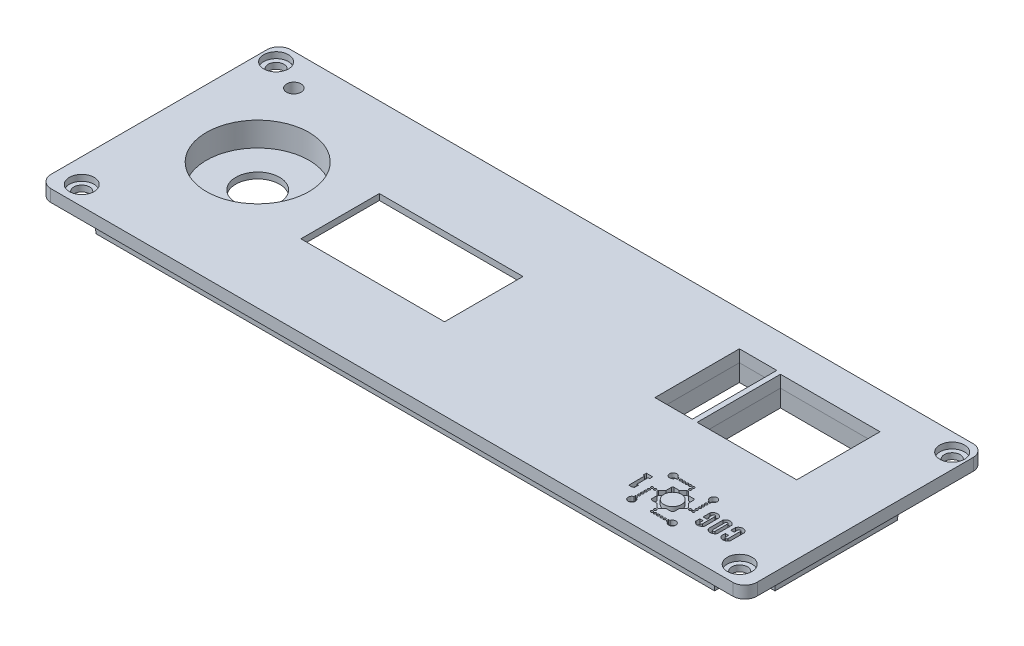
from build123d import *

# Parameters (mm, degrees)
SKETCH1_R                     = 1.3
BOSS_EXTRUDE1_DEPTH           = 2
SKETCH3_W                     = 102.8
SKETCH3_H                     = 1.5
BOSS_EXTRUDE2_DEPTH           = 3
BOSS_EXTRUDE2_DRAFT           = 3
BOSS_EXTRUDE2_PROFILE_2_DEPTH = 3
BOSS_EXTRUDE2_PROFILE_2_DRAFT = 3
SKETCH3_W_2                   = 1.5
SKETCH3_H_2                   = 20.6
BOSS_EXTRUDE2_PROFILE_3_DEPTH = 3
BOSS_EXTRUDE2_PROFILE_3_DRAFT = 3
BOSS_EXTRUDE2_PROFILE_4_DEPTH = 3
BOSS_EXTRUDE2_PROFILE_4_DRAFT = 3
SKETCH6_R                     = 2.05
CUT_EXTRUDE3_DEPTH            = 1
SKETCH8_W                     = 27.3
SKETCH8_H                     = 27.8
BOSS_EXTRUDE16_DEPTH          = 0.5
CUT_EXTRUDE8_DEPTH            = 1.5
SKETCH10_W                    = 23.8
SKETCH10_H                    = 13
CUT_EXTRUDE9_DEPTH            = 1
SKETCH11_R                    = 0.8
BOSS_EXTRUDE6_DEPTH           = 1.2
FILLET1_R                     = 0.6
SKETCH13_R                    = 8.5
SKETCH13_R_2                  = 1.2
CUT_EXTRUDE10_DEPTH           = 2
SKETCH16_R                    = 0.2
SKETCH16_R_2                  = 1.460916741
CUT_EXTRUDE11_DEPTH           = 0.75
BOSS_EXTRUDE17_DEPTH          = 3
BOSS_EXTRUDE9_START           = 3
SKETCH23_R                    = 9.5
SKETCH23_R_2                  = 8.5
BOSS_EXTRUDE9_DEPTH           = 3
SKETCH24_R                    = 9.5
SKETCH24_R_2                  = 3.625
BOSS_EXTRUDE10_DEPTH          = 1
CUT_EXTRUDE14_DEPTH           = 63.02844974
CUT_EXTRUDE14_DEPTH_BACK      = 63.02844974
SKETCH20_W                    = 16.5
SKETCH20_H                    = 13.8
SKETCH20_W_2                  = 6.2
SKETCH20_H_2                  = 14
SKETCH26_W                    = 7.659856529
SKETCH26_H                    = 5
SKETCH26_W_2                  = 5.2
SKETCH26_H_2                  = 11.5
CUT_EXTRUDE16_DEPTH           = 1
BOSS_EXTRUDE20_START          = 13.65
BOSS_EXTRUDE20_DEPTH          = 27.3
BOSS_EXTRUDE22_DEPTH          = 3
BOSS_EXTRUDE22_TAPER          = 3
SKETCH34_R                    = 1.4
BOSS_EXTRUDE23_DEPTH          = 3
BOSS_EXTRUDE24_DEPTH          = 1.2
FILLET2_R                     = 0.5


with BuildPart() as part:
    # Sketch1 → Boss-Extrude1 (new body)
    with BuildSketch(Plane(origin=(0, 0, 0), x_dir=(1, 0, 0), z_dir=(0, 1, 0))):
        with BuildLine():
            Line((58.5, 17.9), (58.5, -17.9))
            ThreePointArc((58.5, -17.9), (57.95, -19.378571429), (56.5, -20))
            Line((56.5, -20), (-56.5, -20))
            ThreePointArc((-56.5, -20), (-57.92, -19.35), (-58.5, -17.9))
            Line((-58.5, -17.9), (-58.5, 17.9))
            ThreePointArc((-58.5, 17.9), (-57.879311422, 19.249275181), (-56.5, 19.8))
            Line((-56.5, 19.8), (56.5, 19.8))
            ThreePointArc((56.5, 19.8), (57.879311422, 19.249275181), (58.5, 17.9))
        make_face()
        with Locations(Location((54.5, -16.85, 0), (0, 0, 270))):
            Circle(SKETCH1_R, mode=Mode.SUBTRACT)
        with Locations(Location((56, 16.85, 0), (0, 0, 90))):
            Circle(SKETCH1_R, mode=Mode.SUBTRACT)
        with Locations(Location((-56, 16.85, 0), (0, 0, 270))):
            Circle(SKETCH1_R, mode=Mode.SUBTRACT)
        with Locations(Location((-54.5, -16.85, 0), (0, 0, 90))):
            Circle(SKETCH1_R, mode=Mode.SUBTRACT)
    extrude(amount=BOSS_EXTRUDE1_DEPTH)


with BuildPart() as boss_extrude2_tool:
    # Sketch3 → Boss-Extrude2 (with draft: the straight prism first)
    with BuildSketch(Plane.XZ):
        with Locations((0, 17.15)):
            Rectangle(SKETCH3_W, SKETCH3_H)
    extrude(amount=BOSS_EXTRUDE2_DEPTH)
    # Boss-Extrude2: the draft: its side faces are tilted about the plane it starts from
    boss_extrude2_sides = [boss_extrude2_tool.faces().sort_by_distance(p)[0] for p in [
        (-51.4, -1.5, 17.15),
        (0, -1.5, 16.4),
        (51.4, -1.5, 17.15),
        (0, -1.5, 17.9),
    ]]
    draft(boss_extrude2_sides, Plane.XZ, BOSS_EXTRUDE2_DRAFT)


with BuildPart() as part_1:
    add(part.part)

    # Boss-Extrude2: add boss_extrude2_tool
    add(boss_extrude2_tool.part)


with BuildPart() as boss_extrude2_profile_2_tool:
    # Sketch3 → Boss-Extrude2 profile 2 (with draft: the straight prism first)
    with BuildSketch(Plane.XZ):
        with Locations((0, -17.15)):
            Rectangle(SKETCH3_W, SKETCH3_H)
    extrude(amount=BOSS_EXTRUDE2_PROFILE_2_DEPTH)
    # Boss-Extrude2 profile 2: the draft: its side faces are tilted about the plane it starts from
    boss_extrude2_profile_2_sides = [boss_extrude2_profile_2_tool.faces().sort_by_distance(p)[0] for p in [
        (51.4, -1.5, -17.15),
        (0, -1.5, -16.4),
        (-51.4, -1.5, -17.15),
        (0, -1.5, -17.9),
    ]]
    draft(boss_extrude2_profile_2_sides, Plane.XZ, BOSS_EXTRUDE2_PROFILE_2_DRAFT)


with BuildPart() as part_2:
    add(part_1.part)

    # Boss-Extrude2 profile 2: add boss_extrude2_profile_2_tool
    add(boss_extrude2_profile_2_tool.part)


with BuildPart() as boss_extrude2_profile_3_tool:
    # Sketch3 → Boss-Extrude2 profile 3 (with draft: the straight prism first)
    with BuildSketch(Plane.XZ):
        with Locations((-55.65, 2.6)):
            Rectangle(SKETCH3_W_2, SKETCH3_H_2)
    extrude(amount=BOSS_EXTRUDE2_PROFILE_3_DEPTH)
    # Boss-Extrude2 profile 3: the draft: its side faces are tilted about the plane it starts from
    boss_extrude2_profile_3_sides = [boss_extrude2_profile_3_tool.faces().sort_by_distance(p)[0] for p in [
        (-56.4, -1.5, 2.6),
        (-55.65, -1.5, -7.7),
        (-54.9, -1.5, 2.6),
        (-55.65, -1.5, 12.9),
    ]]
    draft(boss_extrude2_profile_3_sides, Plane.XZ, BOSS_EXTRUDE2_PROFILE_3_DRAFT)


with BuildPart() as part_3:
    add(part_2.part)

    # Boss-Extrude2 profile 3: add boss_extrude2_profile_3_tool
    add(boss_extrude2_profile_3_tool.part)


with BuildPart() as boss_extrude2_profile_4_tool:
    # Sketch3 → Boss-Extrude2 profile 4 (with draft: the straight prism first)
    with BuildSketch(Plane.XZ):
        with Locations((55.65, 2.6)):
            Rectangle(SKETCH3_W_2, SKETCH3_H_2)
    extrude(amount=BOSS_EXTRUDE2_PROFILE_4_DEPTH)
    # Boss-Extrude2 profile 4: the draft: its side faces are tilted about the plane it starts from
    boss_extrude2_profile_4_sides = [boss_extrude2_profile_4_tool.faces().sort_by_distance(p)[0] for p in [
        (54.9, -1.5, 2.6),
        (55.65, -1.5, -7.7),
        (56.4, -1.5, 2.6),
        (55.65, -1.5, 12.9),
    ]]
    draft(boss_extrude2_profile_4_sides, Plane.XZ, BOSS_EXTRUDE2_PROFILE_4_DRAFT)


with BuildPart() as part_4:
    add(part_3.part)

    # Boss-Extrude2 profile 4: add boss_extrude2_profile_4_tool
    add(boss_extrude2_profile_4_tool.part)

    # Sketch6 → Cut-Extrude3 (cut)
    with BuildSketch(Plane(origin=(0, 2, 0), x_dir=(1, 0, 0), z_dir=(0, 1, 0))):
        with Locations(Location((-56, 16.85, 0), (0, 0, 270))):
            Circle(SKETCH6_R)
        with Locations(Location((-54.5, -16.85, 0), (0, 0, 270))):
            Circle(SKETCH6_R)
        with Locations(Location((54.5, -16.85, 0), (0, 0, 270))):
            Circle(SKETCH6_R)
        with Locations(Location((56, 16.85, 0), (0, 0, 270))):
            Circle(SKETCH6_R)
    extrude(amount=-CUT_EXTRUDE3_DEPTH, mode=Mode.SUBTRACT)

    # Sketch8 → Boss-Extrude16 (add)
    with BuildSketch(Plane.XZ):
        with Locations((-16.65, -2)):
            Rectangle(SKETCH8_W, SKETCH8_H)
    extrude(amount=BOSS_EXTRUDE16_DEPTH)

    # Sketch9 → Cut-Extrude8 (cut)
    with BuildSketch(Plane.XZ.offset(0.5)):
        Polygon((-30.4, 7.73), (-23.8, 7.73), (-23.8, 11.9), (-9.5, 11.9), (-9.5, 7.73), (-2.9, 7.73), (-2.9, -11.84), (-9.5, -11.84), (-9.5, -15.9), (-23.8, -15.9), (-23.8, -11.84), (-30.4, -11.84), align=None)
    extrude(amount=-CUT_EXTRUDE8_DEPTH, mode=Mode.SUBTRACT)

    # Sketch10 → Cut-Extrude9 (cut)
    with BuildSketch(Plane.XZ.offset(-1)):
        with Locations((-16.65, 0)):
            Rectangle(SKETCH10_W, SKETCH10_H)
    extrude(amount=-CUT_EXTRUDE9_DEPTH, mode=Mode.SUBTRACT)

    # Sketch11 → Boss-Extrude6 (add)
    with BuildSketch(Plane.XZ.offset(0.5)):
        with Locations(Location((-5, 9.9, 0), (0, 0, 270))):
            Circle(SKETCH11_R)
        with Locations(Location((-28.3, 9.9, 0), (0, 0, 90))):
            Circle(SKETCH11_R)
    extrude(amount=BOSS_EXTRUDE6_DEPTH)

    # Fillet1
    fillet1_edges = [part_4.edges().sort_by_distance(p)[0] for p in [
        (-5, -1.7, 10.7),
        (-28.3, -1.7, 9.1),
    ]]
    fillet(fillet1_edges, radius=FILLET1_R)

    # Sketch13 → Cut-Extrude10 (cut)
    with BuildSketch(Plane.XZ):
        with Locations(Location((-43.15, -0.95, 0), (0, 0, 270))):
            Circle(SKETCH13_R)
        with Locations(Location((-50.77, -14.55, 0), (0, 0, 270))):
            Circle(SKETCH13_R_2)
    extrude(amount=-CUT_EXTRUDE10_DEPTH, mode=Mode.SUBTRACT)

    # Sketch16 → Cut-Extrude11 (cut)
    # profile 1 of 33: a face of its own
    with BuildSketch(Plane(origin=(0, 2, 0), x_dir=(1, 0, 0), z_dir=(0, 1, 0))):
        with Locations(Location((41.755927372, -16.524528204, 0), (0, 0, 270))):
            Circle(SKETCH16_R)
    # profile 2 of 33: a face of its own
    with BuildSketch(Plane(origin=(0, 2, 0), x_dir=(1, 0, 0), z_dir=(0, 1, 0))):
        with Locations(Location((41.225927372, -16.524528204, 0), (0, 0, 270))):
            Circle(SKETCH16_R)
    # profile 3 of 33: a face of its own
    with BuildSketch(Plane(origin=(0, 2, 0), x_dir=(1, 0, 0), z_dir=(0, 1, 0))):
        with Locations(Location((40.695927372, -16.524528204, 0), (0, 0, 270))):
            Circle(SKETCH16_R)
    # profile 4 of 33: a face of its own
    with BuildSketch(Plane(origin=(0, 2, 0), x_dir=(1, 0, 0), z_dir=(0, 1, 0))):
        with Locations(Location((40.165927372, -16.524528204, 0), (0, 0, 270))):
            Circle(SKETCH16_R)
    # profile 5 of 33: a face of its own
    with BuildSketch(Plane(origin=(0, 2, 0), x_dir=(1, 0, 0), z_dir=(0, 1, 0))):
        with Locations(Location((39.635927372, -16.524528204, 0), (0, 0, 270))):
            Circle(SKETCH16_R)
    # profile 6 of 33: a face of its own
    with BuildSketch(Plane(origin=(0, 2, 0), x_dir=(1, 0, 0), z_dir=(0, 1, 0))):
        with Locations(Location((39.635927372, -15.994528204, 0), (0, 0, 270))):
            Circle(SKETCH16_R)
    # profile 7 of 33: a face of its own
    with BuildSketch(Plane(origin=(0, 2, 0), x_dir=(1, 0, 0), z_dir=(0, 1, 0))):
        with Locations(Location((36.202097677, -15.204967872, 0), (0, 0, 270))):
            Circle(SKETCH16_R)
    # profile 8 of 33: a face of its own
    with BuildSketch(Plane(origin=(0, 2, 0), x_dir=(1, 0, 0), z_dir=(0, 1, 0))):
        with Locations(Location((36.202097677, -14.674967872, 0), (0, 0, 270))):
            Circle(SKETCH16_R)
    # profile 9 of 33: a face of its own
    with BuildSketch(Plane(origin=(0, 2, 0), x_dir=(1, 0, 0), z_dir=(0, 1, 0))):
        with Locations(Location((36.202097677, -14.144967872, 0), (0, 0, 270))):
            Circle(SKETCH16_R)
    # profile 10 of 33: a face of its own
    with BuildSketch(Plane(origin=(0, 2, 0), x_dir=(1, 0, 0), z_dir=(0, 1, 0))):
        with Locations(Location((36.202097677, -13.614967872, 0), (0, 0, 270))):
            Circle(SKETCH16_R)
    # profile 11 of 33: a face of its own
    with BuildSketch(Plane(origin=(0, 2, 0), x_dir=(1, 0, 0), z_dir=(0, 1, 0))):
        with Locations(Location((36.202097677, -13.084967872, 0), (0, 0, 270))):
            Circle(SKETCH16_R)
    # profile 12 of 33: a face of its own
    with BuildSketch(Plane(origin=(0, 2, 0), x_dir=(1, 0, 0), z_dir=(0, 1, 0))):
        with Locations(Location((36.732097677, -13.084967872, 0), (0, 0, 270))):
            Circle(SKETCH16_R)
    # profile 13 of 33: a face of its own
    with BuildSketch(Plane(origin=(0, 2, 0), x_dir=(1, 0, 0), z_dir=(0, 1, 0))):
        with Locations(Location((37.521658009, -9.651138177, 0), (0, 0, 270))):
            Circle(SKETCH16_R)
    # profile 14 of 33: a face of its own
    with BuildSketch(Plane(origin=(0, 2, 0), x_dir=(1, 0, 0), z_dir=(0, 1, 0))):
        with Locations(Location((38.051658009, -9.651138177, 0), (0, 0, 270))):
            Circle(SKETCH16_R)
    # profile 15 of 33: a face of its own
    with BuildSketch(Plane(origin=(0, 2, 0), x_dir=(1, 0, 0), z_dir=(0, 1, 0))):
        with Locations(Location((38.581658009, -9.651138177, 0), (0, 0, 270))):
            Circle(SKETCH16_R)
    # profile 16 of 33: a face of its own
    with BuildSketch(Plane(origin=(0, 2, 0), x_dir=(1, 0, 0), z_dir=(0, 1, 0))):
        with Locations(Location((39.111658009, -9.651138177, 0), (0, 0, 270))):
            Circle(SKETCH16_R)
    # profile 17 of 33: a face of its own
    with BuildSketch(Plane(origin=(0, 2, 0), x_dir=(1, 0, 0), z_dir=(0, 1, 0))):
        with Locations(Location((39.641658009, -9.651138177, 0), (0, 0, 270))):
            Circle(SKETCH16_R)
    # profile 18 of 33: a face of its own
    with BuildSketch(Plane(origin=(0, 2, 0), x_dir=(1, 0, 0), z_dir=(0, 1, 0))):
        with Locations(Location((39.641658009, -10.181138177, 0), (0, 0, 270))):
            Circle(SKETCH16_R)
    # profile 19 of 33: a face of its own
    with BuildSketch(Plane(origin=(0, 2, 0), x_dir=(1, 0, 0), z_dir=(0, 1, 0))):
        with Locations(Location((43.075487704, -10.970698509, 0), (0, 0, 270))):
            Circle(SKETCH16_R)
    # profile 20 of 33: a face of its own
    with BuildSketch(Plane(origin=(0, 2, 0), x_dir=(1, 0, 0), z_dir=(0, 1, 0))):
        with Locations(Location((43.075487704, -11.500698509, 0), (0, 0, 270))):
            Circle(SKETCH16_R)
    # profile 21 of 33: a face of its own
    with BuildSketch(Plane(origin=(0, 2, 0), x_dir=(1, 0, 0), z_dir=(0, 1, 0))):
        with Locations(Location((43.075487704, -12.030698509, 0), (0, 0, 270))):
            Circle(SKETCH16_R)
    # profile 22 of 33: a face of its own
    with BuildSketch(Plane(origin=(0, 2, 0), x_dir=(1, 0, 0), z_dir=(0, 1, 0))):
        with Locations(Location((43.075487704, -12.560698509, 0), (0, 0, 270))):
            Circle(SKETCH16_R)
    # profile 23 of 33: a face of its own
    with BuildSketch(Plane(origin=(0, 2, 0), x_dir=(1, 0, 0), z_dir=(0, 1, 0))):
        with Locations(Location((43.075487704, -13.090698509, 0), (0, 0, 270))):
            Circle(SKETCH16_R)
    # profile 24 of 33: a face of its own
    with BuildSketch(Plane(origin=(0, 2, 0), x_dir=(1, 0, 0), z_dir=(0, 1, 0))):
        with Locations(Location((42.545487704, -13.090698509, 0), (0, 0, 270))):
            Circle(SKETCH16_R)
    # profile 25 of 33: a face of its own
    with BuildSketch(Plane(origin=(0, 2, 0), x_dir=(1, 0, 0), z_dir=(0, 1, 0))):
        with BuildLine():
            Line((50.353379521, -14.289554177), (50.353379521, -11.912502758))
            ThreePointArc((50.353379521, -11.912502758), (49.615677109, -11.409757923), (48.877974697, -11.912502758))
            Line((48.877974697, -11.912502758), (48.877974697, -12.695262432))
            Line((48.877974697, -12.695262432), (49.433013744, -12.695262432))
            Line((49.433013744, -12.695262432), (49.433013744, -12.032443241))
            ThreePointArc((49.433013744, -12.032443241), (49.634213605, -11.874545065), (49.835413465, -12.032443241))
            Line((49.835413465, -12.032443241), (49.835413465, -14.1203687))
            ThreePointArc((49.835413465, -14.1203687), (49.634213605, -14.298782393), (49.433013744, -14.1203687))
            Line((49.433013744, -14.1203687), (49.433013744, -13.611488033))
            Line((49.433013744, -13.611488033), (48.877974697, -13.611488033))
            Line((48.877974697, -13.611488033), (48.877974697, -14.289554177))
            ThreePointArc((48.877974697, -14.289554177), (49.615677109, -14.743057165), (50.353379521, -14.289554177))
        make_face()
    # profile 26 of 33: a face of its own
    with BuildSketch(Plane(origin=(0, 2, 0), x_dir=(1, 0, 0), z_dir=(0, 1, 0))):
        with BuildLine():
            Line((48.241225578, -14.289554177), (48.241225578, -11.912502758))
            ThreePointArc((48.241225578, -11.912502758), (47.504175016, -11.418844063), (46.767124453, -11.912502758))
            Line((46.767124453, -11.912502758), (46.767124453, -14.289554177))
            ThreePointArc((46.767124453, -14.289554177), (47.504175016, -14.743788082), (48.241225578, -14.289554177))
        make_face()
        with BuildLine():
            Line((47.703518525, -12.032443241), (47.703518525, -14.1203687))
            ThreePointArc((47.703518525, -14.1203687), (47.505794988, -14.278022254), (47.30807145, -14.1203687))
            Line((47.30807145, -14.1203687), (47.30807145, -12.032443241))
            ThreePointArc((47.30807145, -12.032443241), (47.505794988, -11.874193328), (47.703518525, -12.032443241))
        make_face(mode=Mode.SUBTRACT)
    # profile 27 of 33: a face of its own
    with BuildSketch(Plane(origin=(0, 2, 0), x_dir=(1, 0, 0), z_dir=(0, 1, 0))):
        with BuildLine():
            Line((46.126723887, -14.289554177), (46.126723887, -11.912502758))
            ThreePointArc((46.126723887, -11.912502758), (45.395336154, -11.412215093), (44.663948422, -11.912502758))
            Line((44.663948422, -11.912502758), (44.663948422, -13.08809853))
            Line((44.663948422, -13.08809853), (45.323801192, -13.08809853))
            Line((45.323801192, -13.08809853), (45.323801192, -12.695262432))
            Line((45.323801192, -12.695262432), (45.201379129, -12.695262432))
            Line((45.201379129, -12.695262432), (45.201379129, -12.032443241))
            ThreePointArc((45.201379129, -12.032443241), (45.397748741, -11.870880719), (45.594118353, -12.032443241))
            Line((45.594118353, -12.032443241), (45.594118353, -14.1203687))
            ThreePointArc((45.594118353, -14.1203687), (45.397748741, -14.277989696), (45.201379129, -14.1203687))
            Line((45.201379129, -14.1203687), (45.201379129, -13.611488033))
            Line((45.201379129, -13.611488033), (44.663948422, -13.611488033))
            Line((44.663948422, -13.611488033), (44.663948422, -14.289554177))
            ThreePointArc((44.663948422, -14.289554177), (45.395336154, -14.741708486), (46.126723887, -14.289554177))
        make_face()
    # profile 28 of 33: a face of its own
    with BuildSketch(Plane(origin=(0, 2, 0), x_dir=(1, 0, 0), z_dir=(0, 1, 0))):
        Polygon((40.404159555, -14.935592255), (41.30977506, -14.935592255), (41.486551756, -14.75881556), (41.486551756, -13.853200055), (42.12691862, -13.21283319), (42.12691862, -12.96283319), (41.486551756, -12.322466326), (41.486551756, -11.416850821), (41.30977506, -11.240074125), (40.404159555, -11.240074125), (39.763792691, -10.599707261), (39.513792691, -10.599707261), (38.873425826, -11.240074125), (37.967810321, -11.240074125), (37.791033625, -11.416850821), (37.791033625, -12.322466326), (37.150666761, -12.96283319), (37.150666761, -13.21283319), (37.791033625, -13.853200055), (37.791033625, -14.75881556), (37.967810321, -14.935592255), (38.873425826, -14.935592255), (39.513792691, -15.57595912), (39.763792691, -15.57595912), align=None)
        with Locations(Location((39.638792691, -13.08783319, 0), (0, 0, 270))):
            Circle(SKETCH16_R_2, mode=Mode.SUBTRACT)
    # profile 29 of 33: a face of its own
    with BuildSketch(Plane(origin=(0, 2, 0), x_dir=(1, 0, 0), z_dir=(0, 1, 0))):
        with BuildLine():
            Line((42.426130916, -16.720006208), (42.150360643, -16.720006208))
            Line((42.150360643, -16.720006208), (42.150360643, -16.323900677))
            Line((42.150360643, -16.323900677), (42.421087755, -16.323900677))
            ThreePointArc((42.421087755, -16.323900677), (43.58987931, -16.507104652), (42.426130916, -16.720006208))
        make_face()
    # profile 30 of 33: a face of its own
    with BuildSketch(Plane(origin=(0, 2, 0), x_dir=(1, 0, 0), z_dir=(0, 1, 0))):
        with BuildLine():
            Line((36.006619673, -15.875171416), (36.006619673, -15.599401143))
            Line((36.006619673, -15.599401143), (36.402725204, -15.599401143))
            Line((36.402725204, -15.599401143), (36.402725204, -15.870128254))
            ThreePointArc((36.402725204, -15.870128254), (36.219521229, -17.03891981), (36.006619673, -15.875171416))
        make_face()
    # profile 31 of 33: a face of its own
    with BuildSketch(Plane(origin=(0, 2, 0), x_dir=(1, 0, 0), z_dir=(0, 1, 0))):
        with BuildLine():
            Line((36.851454465, -9.455660173), (37.127224738, -9.455660173))
            Line((37.127224738, -9.455660173), (37.127224738, -9.851765704))
            Line((37.127224738, -9.851765704), (36.856497627, -9.851765704))
            ThreePointArc((36.856497627, -9.851765704), (35.687706071, -9.668561729), (36.851454465, -9.455660173))
        make_face()
    # profile 32 of 33: a face of its own
    with BuildSketch(Plane(origin=(0, 2, 0), x_dir=(1, 0, 0), z_dir=(0, 1, 0))):
        with BuildLine():
            Line((43.270965708, -10.300494965), (43.270965708, -10.576265238))
            Line((43.270965708, -10.576265238), (42.874860177, -10.576265238))
            Line((42.874860177, -10.576265238), (42.874860177, -10.305538126))
            ThreePointArc((42.874860177, -10.305538126), (43.058064152, -9.136746571), (43.270965708, -10.300494965))
        make_face()
    # profile 33 of 33: a face of its own
    with BuildSketch(Plane(origin=(0, 2, 0), x_dir=(1, 0, 0), z_dir=(0, 1, 0))):
        Polygon((34.750273309, -11.500698509), (34.750273309, -12.030698509), (34.487662834, -12.030698509), (34.487662834, -13.87062901), (34.750273309, -13.87062901), (34.750273309, -14.538356186), (34.487662834, -14.675498552), (33.94833624, -14.675498552), (33.94833624, -12.030698509), (33.682042339, -12.030698509), (33.682042339, -11.500698509), align=None)
    extrude(amount=-CUT_EXTRUDE11_DEPTH, mode=Mode.SUBTRACT)

    # Sketch29 → Boss-Extrude17 (add)
    with BuildSketch(Plane.XZ):
        Polygon((-50.77, -15.5), (-51.27, -16.5), (-50.27, -16.5), align=None)
        Polygon((-51.72, -14.55), (-52.72, -14.05), (-52.72, -15.05), align=None)
        Polygon((-50.77, -13.6), (-50.27, -12.6), (-51.27, -12.6), align=None)
        Polygon((-49.82, -14.55), (-48.82, -15.05), (-48.82, -14.05), align=None)
    extrude(amount=BOSS_EXTRUDE17_DEPTH)

    # Sketch23 → Boss-Extrude9 (add)
    with BuildSketch(Plane.XZ.offset(BOSS_EXTRUDE9_START)):
        with Locations(Location((-43.15, -0.95, 0), (0, 0, 270))):
            Circle(SKETCH23_R)
        with Locations(Location((-43.15, -0.95, 0), (0, 0, 270))):
            Circle(SKETCH23_R_2, mode=Mode.SUBTRACT)
    extrude(amount=-BOSS_EXTRUDE9_DEPTH)

    # Sketch24 → Boss-Extrude10 (add)
    with BuildSketch(Plane.XZ.offset(3)):
        with Locations(Location((-43.15, -0.95, 0), (0, 0, 270))):
            Circle(SKETCH24_R)
        with Locations(Location((-43.15, -0.95, 0), (0, 0, 270))):
            Circle(SKETCH24_R_2, mode=Mode.SUBTRACT)
    extrude(amount=-BOSS_EXTRUDE10_DEPTH)

    # Sketch20 → Cut-Extrude14 (cut, two sides: drawn at the far end of the back side and taken through both)
    with BuildSketch(Plane(origin=(0, 2, 0), x_dir=(1, 0, 0), z_dir=(0, 1, 0)).offset(-CUT_EXTRUDE14_DEPTH_BACK)):
        with Locations((38.85, 6.9)):
            Rectangle(SKETCH20_W, SKETCH20_H)
        with Locations((26.65, 7.05)):
            Rectangle(SKETCH20_W_2, SKETCH20_H_2)
    extrude(amount=CUT_EXTRUDE14_DEPTH + CUT_EXTRUDE14_DEPTH_BACK, mode=Mode.SUBTRACT)

    # Sketch26 → Cut-Extrude16 (cut)
    with BuildSketch(Plane(origin=(0, 0, 2), x_dir=(1, 0, 0), z_dir=(0, 1, 0))):
        with Locations((7.599355521, 3.8)):
            Rectangle(SKETCH26_W, SKETCH26_H)
        with Locations((18, 7.05)):
            Rectangle(SKETCH26_W_2, SKETCH26_H_2)
    extrude(amount=CUT_EXTRUDE16_DEPTH, mode=Mode.SUBTRACT)

    # Sketch30 → Boss-Extrude20 (add)
    with BuildSketch(Plane(origin=(-16.65, 0, 0), x_dir=(0, 0, 1), z_dir=(1, 0, 0)).offset(BOSS_EXTRUDE20_START)):
        with BuildLine():
            Line((-16.491713614, 1.75), (-16.544121393, 2.75))
            Line((-16.544121393, 2.75), (-16.091713614, 2.75))
            ThreePointArc((-16.091713614, 2.75), (-15.84422624, 2.647487373), (-15.741713614, 2.4))
            Line((-15.741713614, 2.4), (-15.741713614, 2.25))
            ThreePointArc((-15.741713614, 2.25), (-15.888160223, 1.896446609), (-16.241713614, 1.75))
            Line((-16.241713614, 1.75), (-16.491713614, 1.75))
        make_face()
    extrude(amount=-BOSS_EXTRUDE20_DEPTH)

    # Sketch33 → Boss-Extrude22 (add)
    with BuildSketch(Plane.XZ):
        Polygon((23.55, -0.25), (22.55, -0.25), (22.55, -15.05), (48.1, -15.05), (48.1, -0.25), (47.1, -0.25), (47.1, -13.8), (30.6, -13.8), (30.6, -0.25), (29.75, -0.25), (29.75, -14.05), (23.55, -14.05), align=None)
    extrude(amount=BOSS_EXTRUDE22_DEPTH, taper=BOSS_EXTRUDE22_TAPER)

    # Sketch34 → Boss-Extrude23 (add)
    with BuildSketch(Plane.XZ):
        with BuildLine():
            Line((-51.549422863, -12.6), (-49.990577137, -12.6))
            ThreePointArc((-49.990577137, -12.6), (-50.77, -16.65), (-51.549422863, -12.6))
        make_face()
        with Locations((-50.77, -14.55)):
            Circle(SKETCH34_R, mode=Mode.SUBTRACT)
    extrude(amount=BOSS_EXTRUDE23_DEPTH)

    # Sketch35 → Boss-Extrude24 (add)
    with BuildSketch(Plane(origin=(0, -1.8, 0), x_dir=(-1, 0, 0), z_dir=(0, -1, 0))):
        Polygon((14.65, -16.557223338), (18.65, -16.557223338), (30.3, -10.4), (30.3, -9.268925181), (19.697103502, -14.872736492), (13.602896498, -14.872736492), (3, -9.268925181), (3, -10.4), align=None)
    extrude(amount=BOSS_EXTRUDE24_DEPTH)

    # Fillet2
    fillet2_edges = [part_4.edges().sort_by_distance(p)[0] for p in [
        (-3, -2.4, 9.268925181),
        (-3, -2.4, 10.4),
        (-30.3, -2.4, 10.4),
        (-30.3, -2.4, 9.268925181),
        (-19.697103502, -2.4, 14.872736492),
        (-13.602896498, -2.4, 14.872736492),
        (-14.590503965, -2.4, 16.52577867),
        (-18.709496035, -2.4, 16.52577867),
    ]]
    fillet(fillet2_edges, radius=FILLET2_R - 0.0001)  # a hair under: the kernel refuses the full size


solid = part_4.part
